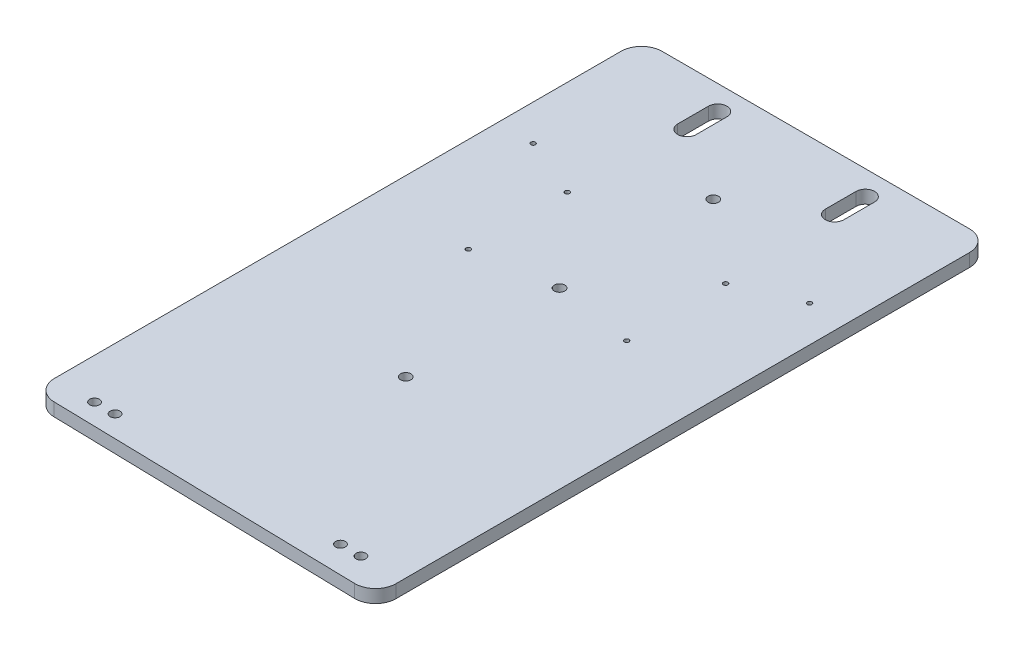
from build123d import *

# Parameters (mm, degrees)
PLATE_DEPTH                          = 6.35
FILLET1_R                            = 10
TRIPOD_SOCKET_TAP_DRILL_FOR_1_4_20_D = 5.1054
CAMERA_MOUNT_SCREW_CLEARANCE_DEPTH   = 352.602633461
ALIGNMENT_TAP_DRILL_FOR_M2_5_D       = 2.2352
CLAMP_TAP_DRILL_FOR_M2_5_D           = 2.2352
SKETCH11_R                           = 2.38125
CABLE_TIES_HOLES_DEPTH               = 352.602633461


with BuildPart() as part:
    # Sketch1 → plate (new body)
    with BuildSketch(Plane(origin=(0, 0, 0), x_dir=(1, 0, 0), z_dir=(0, 1, 0))):
        Polygon((13.637433785, 0), (183.637433785, 0), (183.637433785, -300), (13.637433785, -296.115361978), align=None)
    extrude(amount=PLATE_DEPTH)

    # Fillet1
    fillet1_edges = [part.edges().sort_by_distance(p)[0] for p in [
        (183.637433785, 3.175, 300),
        (13.637433785, 3.175, 296.115361978),
        (13.637433785, 3.175, 0),
        (183.637433785, 3.175, 0),
    ]]
    fillet(fillet1_edges, radius=FILLET1_R)

    # tripod socket Tap Drill for 1/4-20 (through all)
    with Locations(Plane(origin=(0, 0, 0), x_dir=(-1, 0, 0), z_dir=(0, -1, 0))):
        with Locations((-98.637433785, -50), (-98.637433785, -125), (-98.637433785, -200)):
            Hole(TRIPOD_SOCKET_TAP_DRILL_FOR_1_4_20_D / 2)

    # Sketch6 → camera mount screw clearance (cut, through all)
    with BuildSketch(Plane(origin=(0, 6.35, 0), x_dir=(1, 0, 0), z_dir=(0, 1, 0))):
        with BuildLine():
            Line((130.137433785, -26.845059814), (130.137433785, -11.845059814))
            ThreePointArc((130.137433785, -11.845059814), (134.637433785, -7.345059814), (139.137433785, -11.845059814))
            Line((139.137433785, -11.845059814), (139.137433785, -26.845059814))
            ThreePointArc((139.137433785, -26.845059814), (134.637433785, -31.345059814), (130.137433785, -26.845059814))
        make_face()
        with BuildLine():
            Line((58.137433785, -26.845059814), (58.137433785, -11.845059814))
            ThreePointArc((58.137433785, -11.845059814), (62.637433785, -7.345059814), (67.137433785, -11.845059814))
            Line((67.137433785, -11.845059814), (67.137433785, -26.845059814))
            ThreePointArc((67.137433785, -26.845059814), (62.637433785, -31.345059814), (58.137433785, -26.845059814))
        make_face()
    extrude(amount=-CAMERA_MOUNT_SCREW_CLEARANCE_DEPTH, mode=Mode.SUBTRACT)

    # alignment Tap Drill for M2.5 (through all)
    with Locations(Plane(origin=(0, 6.35, 0), x_dir=(1, 0, 0), z_dir=(0, 1, 0))):
        with Locations((60.027433785, -82.595059814), (137.247433785, -82.595059814), (137.247433785, -130.855059814), (60.027433785, -130.855059814)):
            Hole(ALIGNMENT_TAP_DRILL_FOR_M2_5_D / 2)

    # clamp Tap Drill for M2.5 (through all)
    with Locations(Plane(origin=(0, 6.35, 0), x_dir=(1, 0, 0), z_dir=(0, 1, 0))):
        with Locations((31.137433785, -70.35), (166.029512109, -70.453390828)):
            Hole(CLAMP_TAP_DRILL_FOR_M2_5_D / 2)

    # Sketch11 → cable ties holes (cut, through all)
    with BuildSketch(Plane(origin=(0, 6.35, 0), x_dir=(1, 0, 0), z_dir=(0, 1, 0))):
        with Locations((33.408985301, -286.564547525)):
            Circle(SKETCH11_R)
        with Locations((43.408985301, -286.564547525)):
            Circle(SKETCH11_R)
        with Locations((153.426530966, -286.648872752)):
            Circle(SKETCH11_R)
        with Locations((163.426519217, -286.664202157)):
            Circle(SKETCH11_R)
    extrude(amount=-CABLE_TIES_HOLES_DEPTH, mode=Mode.SUBTRACT)


solid = part.part
